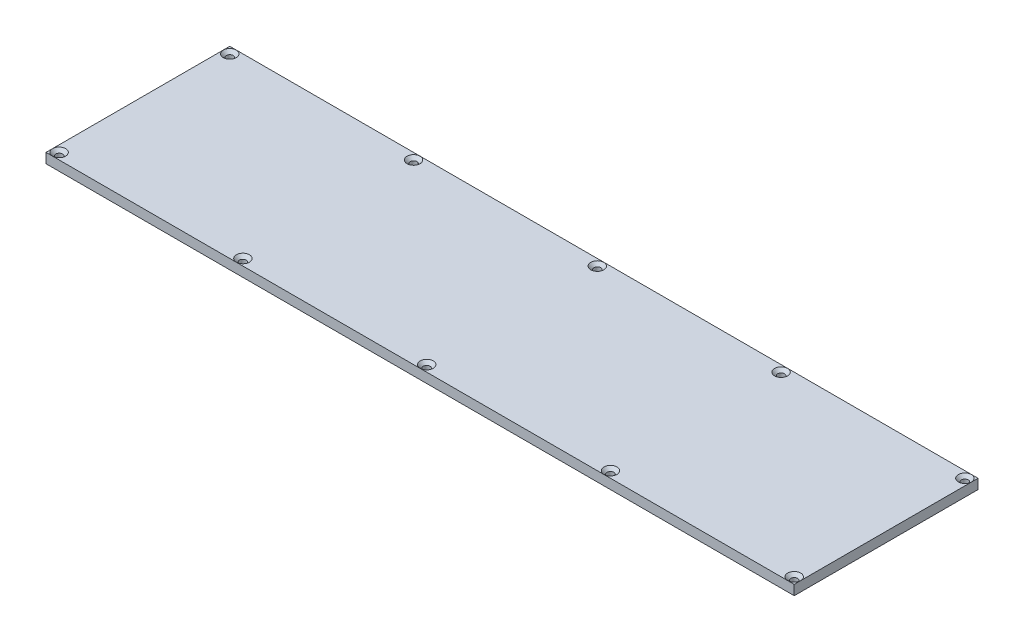
from build123d import *

# Parameters (mm, degrees)
SKETCH1_W                                       = 723.9
SKETCH1_H                                       = 177.8
BOSS_EXTRUDE1_DEPTH                             = 9.525
CSK_FOR_M6_FLAT_HEAD_MACHINE_SCREW1_D           = 6.6
CSK_FOR_M6_FLAT_HEAD_MACHINE_SCREW1_CSINK_D     = 12.6
CSK_FOR_M6_FLAT_HEAD_MACHINE_SCREW1_CSINK_ANGLE = 90


with BuildPart() as part:
    # Sketch1 → Boss-Extrude1 (new body)
    with BuildSketch(Plane(origin=(0, 0, 0), x_dir=(1, 0, 0), z_dir=(0, 1, 0))):
        Rectangle(SKETCH1_W, SKETCH1_H)
    extrude(amount=BOSS_EXTRUDE1_DEPTH)

    # CSK for M6 Flat Head Machine Screw1 (through all)
    with Locations(Plane(origin=(0, 9.525, 0), x_dir=(1, 0, 0), z_dir=(0, 1, 0))):
        with Locations((355.6, 82.55), (-355.6, 82.55), (355.6, -82.55), (-355.6, -82.55), (-177.8, 82.55), (177.8, 82.55), (-177.8, -82.55), (177.8, -82.55), (0, -82.55), (0, 82.55)):
            CounterSinkHole(CSK_FOR_M6_FLAT_HEAD_MACHINE_SCREW1_D / 2, CSK_FOR_M6_FLAT_HEAD_MACHINE_SCREW1_CSINK_D / 2, counter_sink_angle=CSK_FOR_M6_FLAT_HEAD_MACHINE_SCREW1_CSINK_ANGLE)


solid = part.part
